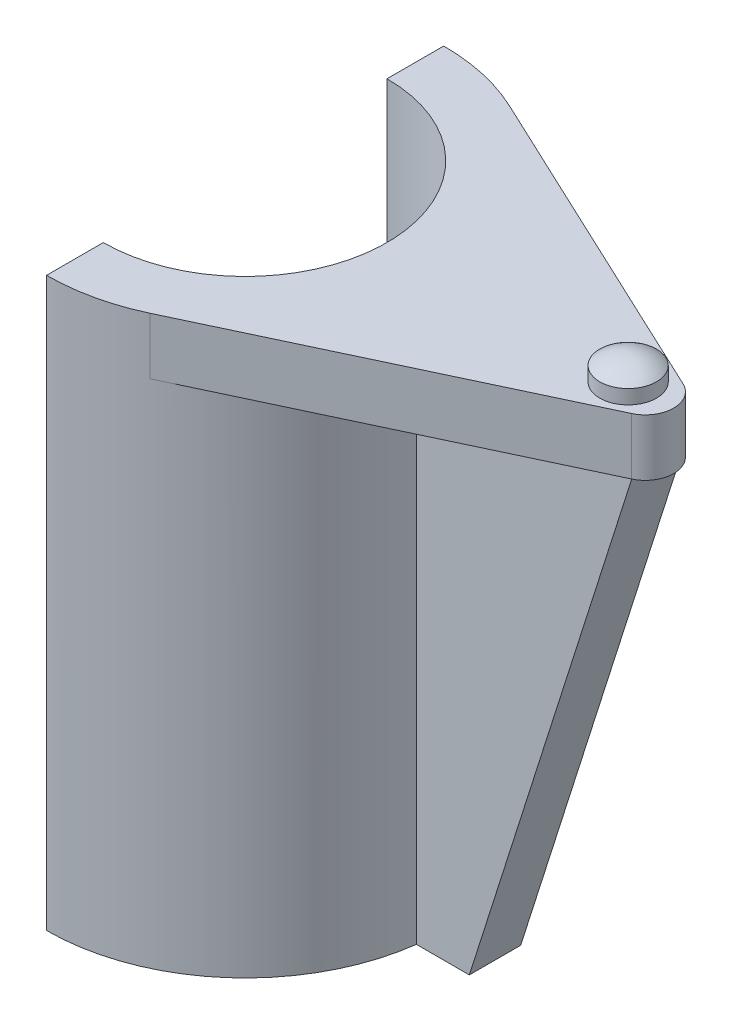
from build123d import *

# Parameters (mm, degrees)
Y_KSEKLIK_EKSTR_ZYON1_DEPTH = 400
Y_KSEKLIK_EKSTR_ZYON3_DEPTH = 40
Y_KSEKLIK_EKSTR_ZYON4_DEPTH = 360
IZIM16_R                    = 20
Y_KSEKLIK_EKSTR_ZYON5_DEPTH = 10
IZIM17_R                    = 8
KES_EKSTR_ZYON21_DEPTH      = 50
IZIM19_W                    = 11.493054453
IZIM19_H                    = 360
KES_EKSTR_ZYON23_DEPTH      = 170
KES_EKSTR_ZYON24_DEPTH      = 170


# Read off the part's stored shape, not the designer's step: Kubbe1
with BuildPart() as part:
    # Çizim1 → Yükseklik-Ekstrüzyon1 (new body)
    with BuildSketch(Plane(origin=(0, 0, 0), x_dir=(1, 0, 0), z_dir=(0, 1, 0))):
        with BuildLine():
            Line((0, 140), (0, 100))
            ThreePointArc((0, 100), (100, 0), (0, -100))
            Line((0, -100), (0, -140))
            ThreePointArc((0, -140), (140, 0), (0, 140))
        make_face()
    extrude(amount=-Y_KSEKLIK_EKSTR_ZYON1_DEPTH)

    # Çizim2 → Yükseklik-Ekstrüzyon3 (add)
    with BuildSketch(Plane(origin=(0, 0, 0), x_dir=(1, 0, 0), z_dir=(0, 1, 0))):
        with BuildLine():
            Line((59.548618827, 126.704230378), (290.629357971, 18.10060434))
            ThreePointArc((290.629357971, 18.10060434), (302.122412424, 0), (290.629357971, -18.10060434))
            Line((290.629357971, -18.10060434), (59.548618827, -126.704230378))
            ThreePointArc((59.548618827, -126.704230378), (30.507439642, -136.635632712), (0, -140))
            Line((0, -140), (0, -100))
            ThreePointArc((0, -100), (100, 0), (0, 100))
            Line((0, 100), (0, 140))
            ThreePointArc((0, 140), (30.507439642, 136.635632712), (59.548618827, 126.704230378))
        make_face()
    extrude(amount=-Y_KSEKLIK_EKSTR_ZYON3_DEPTH)

    # Çizim5 → Yükseklik-Ekstrüzyon4 (add)
    with BuildSketch(Plane(origin=(0, -40, 0), x_dir=(1, 0, 0), z_dir=(0, 1, 0))):
        with BuildLine():
            Line((290.629357971, 18.10060434), (98.34819837, 18.10060434))
            ThreePointArc((98.34819837, 18.10060434), (100, 0), (98.34819837, -18.10060434))
            Line((98.34819837, -18.10060434), (290.629357971, -18.10060434))
            ThreePointArc((290.629357971, -18.10060434), (302.122412424, 0), (290.629357971, 18.10060434))
        make_face()
    extrude(amount=-Y_KSEKLIK_EKSTR_ZYON4_DEPTH)

    # Çizim16 → Yükseklik-Ekstrüzyon5 (add)
    with BuildSketch(Plane(origin=(0, 0, 0), x_dir=(1, 0, 0), z_dir=(0, 1, 0))):
        with Locations(Location((270, 0, 0), (0, 0, 270))):
            Circle(IZIM16_R)
    extrude(amount=Y_KSEKLIK_EKSTR_ZYON5_DEPTH)

    # Kubbe1 outline → Kubbe1 (revolve)
    with BuildSketch(Plane(origin=(270, 0, 0), x_dir=(1, 0, 0), z_dir=(0, 0, 1))):
        with BuildLine():
            Line((0, 10), (20.000000025, 9.99999998))
            ThreePointArc((20.000000025, 9.99999998), (10.594810065, 15.199457281), (0, 17))
            Line((0, 17), (0, 10))
        make_face()
    revolve(axis=Axis((270, 0, 0), (0, 1, 0)))

    # Çizim17 → Kes-Ekstrüzyon21 (cut)
    with BuildSketch(Plane.ZY):
        with Locations((120, -50)):
            Circle(IZIM17_R)
        with Locations((120, -110)):
            Circle(IZIM17_R)
        with Locations((120, -170)):
            Circle(IZIM17_R)
        with Locations((120, -230)):
            Circle(IZIM17_R)
        with Locations((120, -290)):
            Circle(IZIM17_R)
        with Locations((120, -350)):
            Circle(IZIM17_R)
        with Locations(Location((-120, -350, 0), (0, 0, 180))):
            Circle(IZIM17_R)
        with Locations(Location((-120, -290, 0), (0, 0, 180))):
            Circle(IZIM17_R)
        with Locations(Location((-120, -230, 0), (0, 0, 180))):
            Circle(IZIM17_R)
        with Locations(Location((-120, -170, 0), (0, 0, 180))):
            Circle(IZIM17_R)
        with Locations(Location((-120, -110, 0), (0, 0, 180))):
            Circle(IZIM17_R)
        with Locations(Location((-120, -50, 0), (0, 0, 180))):
            Circle(IZIM17_R)
    extrude(amount=-KES_EKSTR_ZYON21_DEPTH, mode=Mode.SUBTRACT)

    # Çizim19 → Kes-Ekstrüzyon23 (cut)
    with BuildSketch(Plane.XY.offset(18.10060434)):
        with Locations((296.375885197, -220)):
            Rectangle(IZIM19_W, IZIM19_H)
    extrude(amount=-KES_EKSTR_ZYON23_DEPTH, mode=Mode.SUBTRACT)

    # Çizim21 → Kes-Ekstrüzyon24 (cut)
    with BuildSketch(Plane.XY.offset(18.10060434)):
        Polygon((290.629357971, -40), (176.145834142, -400), (290.629357971, -400), align=None)
    extrude(amount=-KES_EKSTR_ZYON24_DEPTH, mode=Mode.SUBTRACT)


solid = part.part
